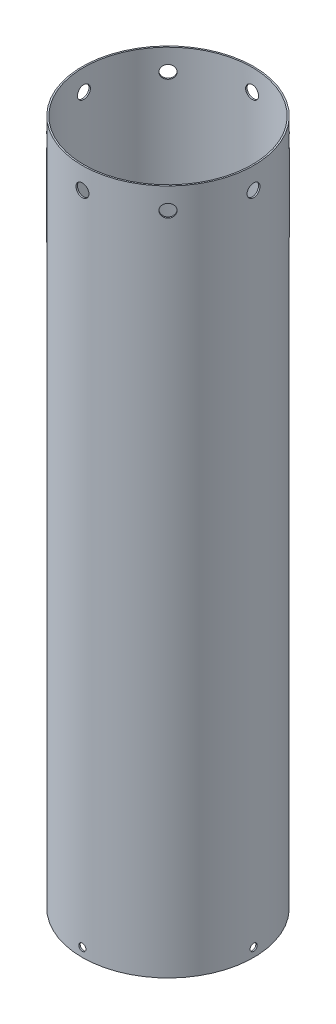
from build123d import *

# Parameters (mm, degrees)
SKETCH1_R           = 76.2
BOSS_EXTRUDE1_DEPTH = 609.6
SKETCH2_R           = 74.93
CUT_EXTRUDE1_DEPTH  = 620.051726433
SKETCH3_R           = 5.715
CUT_EXTRUDE2_DEPTH  = 620.051726433
CIRPATTERN1_COUNT   = 8
SKETCH4_R           = 3.175
CUT_EXTRUDE3_DEPTH  = 620.051726557
CIRPATTERN2_COUNT   = 4


with BuildPart() as part:
    # Sketch1 → Boss-Extrude1 (new body)
    with BuildSketch(Plane(origin=(0, 0, 0), x_dir=(1, 0, 0), z_dir=(0, 1, 0))):
        Circle(SKETCH1_R)
    extrude(amount=BOSS_EXTRUDE1_DEPTH)

    # Sketch2 → Cut-Extrude1 (cut, through all)
    with BuildSketch(Plane(origin=(0, 609.6, 0), x_dir=(1, 0, 0), z_dir=(0, 1, 0))):
        Circle(SKETCH2_R)
    extrude(amount=-CUT_EXTRUDE1_DEPTH, mode=Mode.SUBTRACT)

    # Sketch3 → Cut-Extrude2 (cut, symmetric)
    with BuildSketch(Plane.XY):
        with Locations((0, 590.55)):
            Circle(SKETCH3_R)
    cut_extrude2 = extrude(amount=CUT_EXTRUDE2_DEPTH, both=True, mode=Mode.SUBTRACT)

    # CirPattern1: Cut-Extrude2 ×8 about axis
    cirpattern1_axis = Axis((0, 609.6, 0), (0, -1, 0))
    for i in range(1, CIRPATTERN1_COUNT):
        add(cut_extrude2.rotate(cirpattern1_axis, i * 360 / CIRPATTERN1_COUNT), mode=Mode.SUBTRACT)

    # Sketch4 → Cut-Extrude3 (cut, symmetric)
    with BuildSketch(Plane.XY):
        with Locations((0, 7.9375)):
            Circle(SKETCH4_R)
    cut_extrude3 = extrude(amount=CUT_EXTRUDE3_DEPTH, both=True, mode=Mode.SUBTRACT)

    # CirPattern2: Cut-Extrude3 ×4 about axis
    cirpattern2_axis = Axis((0, 609.6, 0), (0, -1, 0))
    for i in range(1, CIRPATTERN2_COUNT):
        add(cut_extrude3.rotate(cirpattern2_axis, i * 360 / CIRPATTERN2_COUNT), mode=Mode.SUBTRACT)


solid = part.part
